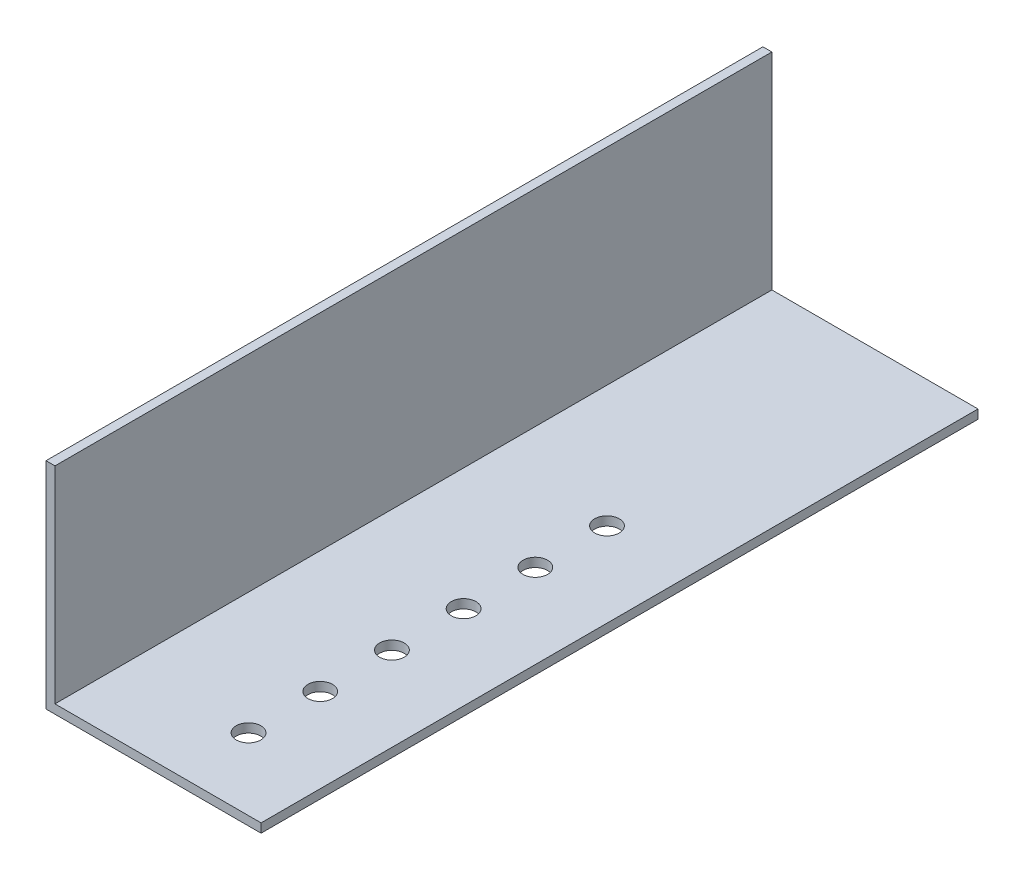
from build123d import *

# Parameters (mm, degrees)
BOSS_EXTRUDE1_DEPTH = 127
SKETCH2_R           = 2.1828125
CUT_EXTRUDE1_DEPTH  = 127


with BuildPart() as part:
    # Sketch1 → Boss-Extrude1 (new body)
    with BuildSketch(Plane.XY):
        Polygon((0, 0), (0, 38.1), (1.5875, 38.1), (1.5875, 1.5875), (38.1, 1.5875), (38.1, 0), align=None)
    extrude(amount=BOSS_EXTRUDE1_DEPTH)

    # Sketch2 → Cut-Extrude1 (cut)
    with BuildSketch(Plane(origin=(0, 1.5875, 0), x_dir=(1, 0, 0), z_dir=(0, 1, 0))):
        with Locations((23.1775, -114.3)):
            Circle(SKETCH2_R)
        with Locations((23.1775, -101.6)):
            Circle(SKETCH2_R)
        with Locations((23.1775, -88.9)):
            Circle(SKETCH2_R)
        with Locations((23.1775, -76.2)):
            Circle(SKETCH2_R)
        with Locations((23.1775, -63.5)):
            Circle(SKETCH2_R)
        with Locations((23.1775, -50.8)):
            Circle(SKETCH2_R)
    extrude(amount=-CUT_EXTRUDE1_DEPTH, mode=Mode.SUBTRACT)


solid = part.part
